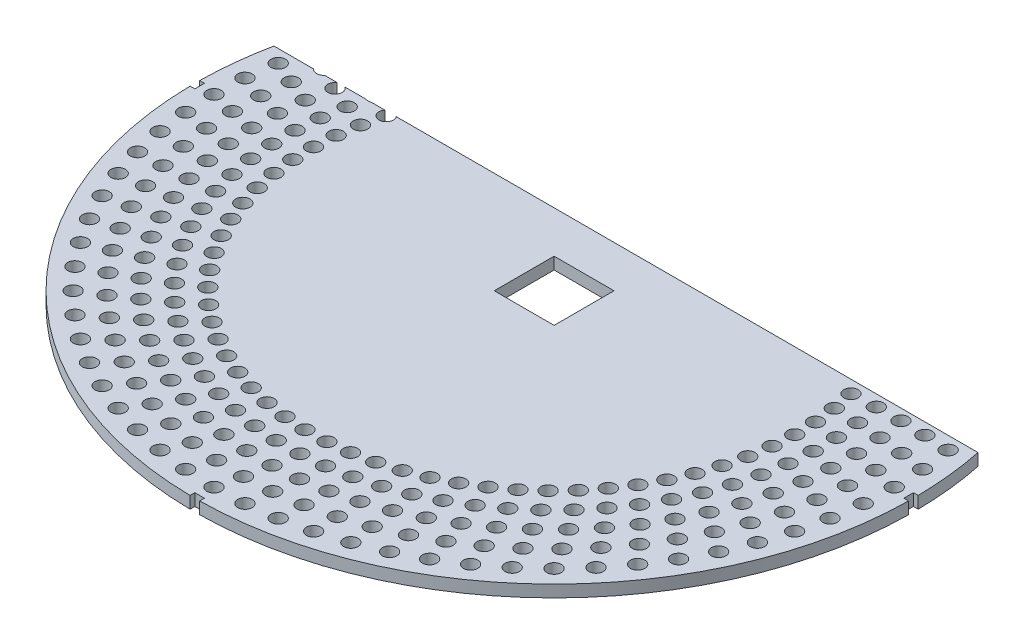
from build123d import *

# Parameters (mm, degrees)
SKETCH1_R           = 150
SKETCH1_W           = 25
SKETCH1_H           = 25
BOSS_EXTRUDE1_DEPTH = 5
SKETCH4_R           = 3
CUT_EXTRUDE3_DEPTH  = 10
CIRPATTERN3_COUNT   = 72
SKETCH10_W          = 4
SKETCH10_H          = 4
CUT_EXTRUDE4_DEPTH  = 5
CIRPATTERN4_COUNT   = 4
CUT_EXTRUDE5_START  = -30
SKETCH11_W          = 300
SKETCH11_H          = 20
CUT_EXTRUDE5_DEPTH  = 150


with BuildPart() as part:
    # Sketch1 → Boss-Extrude1 (new body)
    with BuildSketch(Plane(origin=(0, 0, 0), x_dir=(1, 0, 0), z_dir=(0, 1, 0))):
        Circle(SKETCH1_R)
        Rectangle(SKETCH1_W, SKETCH1_H, mode=Mode.SUBTRACT)
    extrude(amount=BOSS_EXTRUDE1_DEPTH)

    # Sketch4 → Cut-Extrude3 (cut)
    with BuildSketch(Plane(origin=(0, 5, 0), x_dir=(1, 0, 0), z_dir=(0, 1, 0))):
        with Locations((-142, 0)):
            Circle(SKETCH4_R)
        with Locations((-132, -2.304068571)):
            Circle(SKETCH4_R)
        with Locations((-122, -4.260333878)):
            Circle(SKETCH4_R)
        with Locations((-112, -5.86967128)):
            Circle(SKETCH4_R)
        with Locations((-102, -7.132534818)):
            Circle(SKETCH4_R)
    cut_extrude3 = extrude(amount=-CUT_EXTRUDE3_DEPTH, mode=Mode.SUBTRACT)

    # CirPattern3: Cut-Extrude3 ×72 about axis
    cirpattern3_axis = Axis((0, 5, 0), (0, 1, 0))
    for i in range(1, CIRPATTERN3_COUNT):
        add(cut_extrude3.rotate(cirpattern3_axis, i * 360 / CIRPATTERN3_COUNT), mode=Mode.SUBTRACT)

    # Sketch10 → Cut-Extrude4 (cut)
    with BuildSketch(Plane(origin=(0, 5, 0), x_dir=(1, 0, 0), z_dir=(0, 1, 0))):
        with Locations((0, -150)):
            Rectangle(SKETCH10_W, SKETCH10_H)
    cut_extrude4 = extrude(amount=-CUT_EXTRUDE4_DEPTH, mode=Mode.SUBTRACT)

    # CirPattern4: Cut-Extrude4 ×4 about axis
    cirpattern4_axis = Axis((0, 5, 0), (0, 1, 0))
    for i in range(1, CIRPATTERN4_COUNT):
        add(cut_extrude4.rotate(cirpattern4_axis, i * 360 / CIRPATTERN4_COUNT), mode=Mode.SUBTRACT)

    # Sketch11 → Cut-Extrude5 (cut)
    with BuildSketch(Plane.XY.offset(CUT_EXTRUDE5_START)):
        Rectangle(SKETCH11_W, SKETCH11_H)
    extrude(amount=-CUT_EXTRUDE5_DEPTH, mode=Mode.SUBTRACT)


solid = part.part
